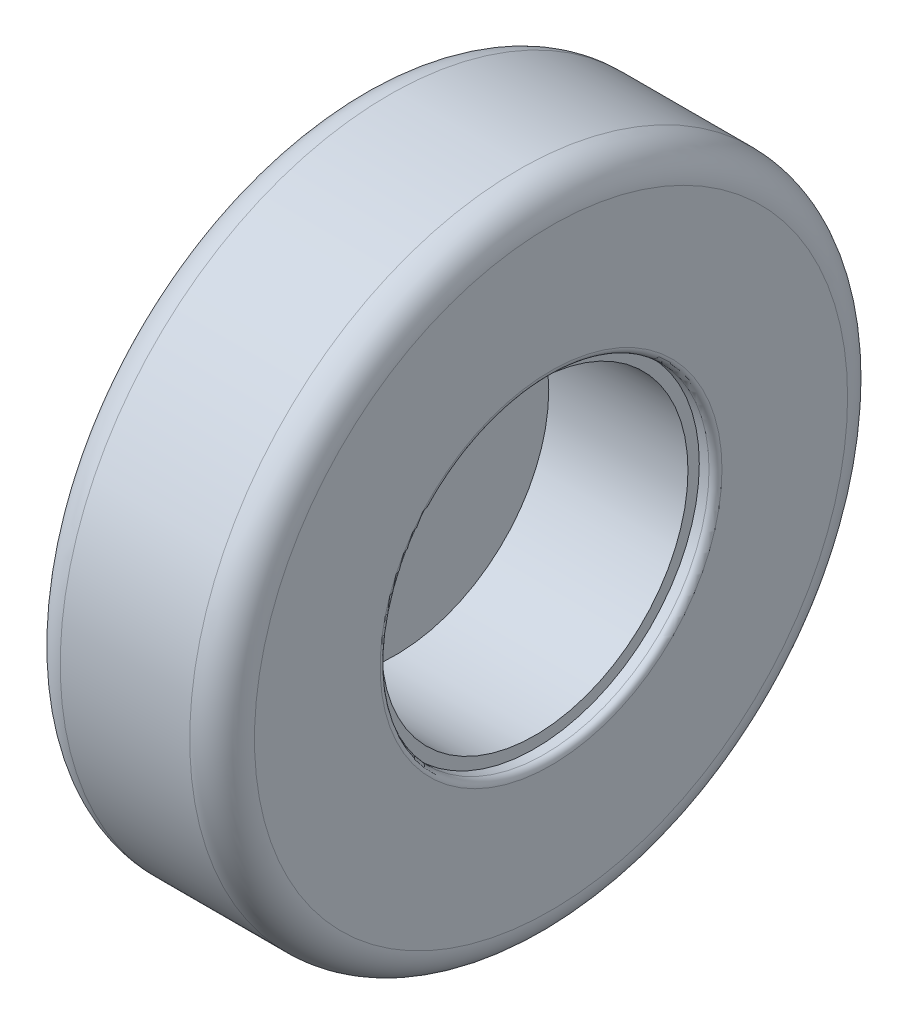
from build123d import *

# Parameters (mm, degrees)
HUB_START      = 5
SKETCH1_R      = 50.8
SKETCH1_R_2    = 7.625
HUB_FACE_DEPTH = 7
SKETCH2_R      = 50.8
SKETCH2_R_2    = 47.3
HUB_DEPTH      = 50
SKETCH3_R      = 101.6
SKETCH3_R_2    = 50.8
RUBBER_DEPTH   = 60
FILLET1_R      = 10
FILLET2_R      = 2


with BuildPart() as part:
    # Sketch1 → Hub Face (new body)
    with BuildSketch(Plane(origin=(0, 0, 0), x_dir=(0, 0, -1), z_dir=(1, 0, 0)).offset(HUB_START)):
        Circle(SKETCH1_R)
        Circle(SKETCH1_R_2, mode=Mode.SUBTRACT)
    extrude(amount=HUB_FACE_DEPTH)

    # Sketch2 → Hub (add)
    with BuildSketch(Plane(origin=(0, 0, 0), x_dir=(0, 0, -1), z_dir=(1, 0, 0)).offset(HUB_START)):
        Circle(SKETCH2_R)
        Circle(SKETCH2_R_2, mode=Mode.SUBTRACT)
    extrude(amount=HUB_DEPTH)

    # Sketch3 → Rubber (add)
    with BuildSketch(Plane(origin=(0, 0, 0), x_dir=(0, 0, -1), z_dir=(1, 0, 0))):
        Circle(SKETCH3_R)
        Circle(SKETCH3_R_2, mode=Mode.SUBTRACT)
    extrude(amount=RUBBER_DEPTH)

    # Fillet1
    fillet1_edges = [part.edges().sort_by_distance(p)[0] for p in [
        (0, 0, 101.6),
        (60, 0, 101.6),
    ]]
    fillet(fillet1_edges, radius=FILLET1_R)

    # Fillet2
    fillet2_edges = [part.edges().sort_by_distance(p)[0] for p in [
        (60, 0, 50.8),
        (0, 0, 50.8),
    ]]
    fillet(fillet2_edges, radius=FILLET2_R)


solid = part.part
